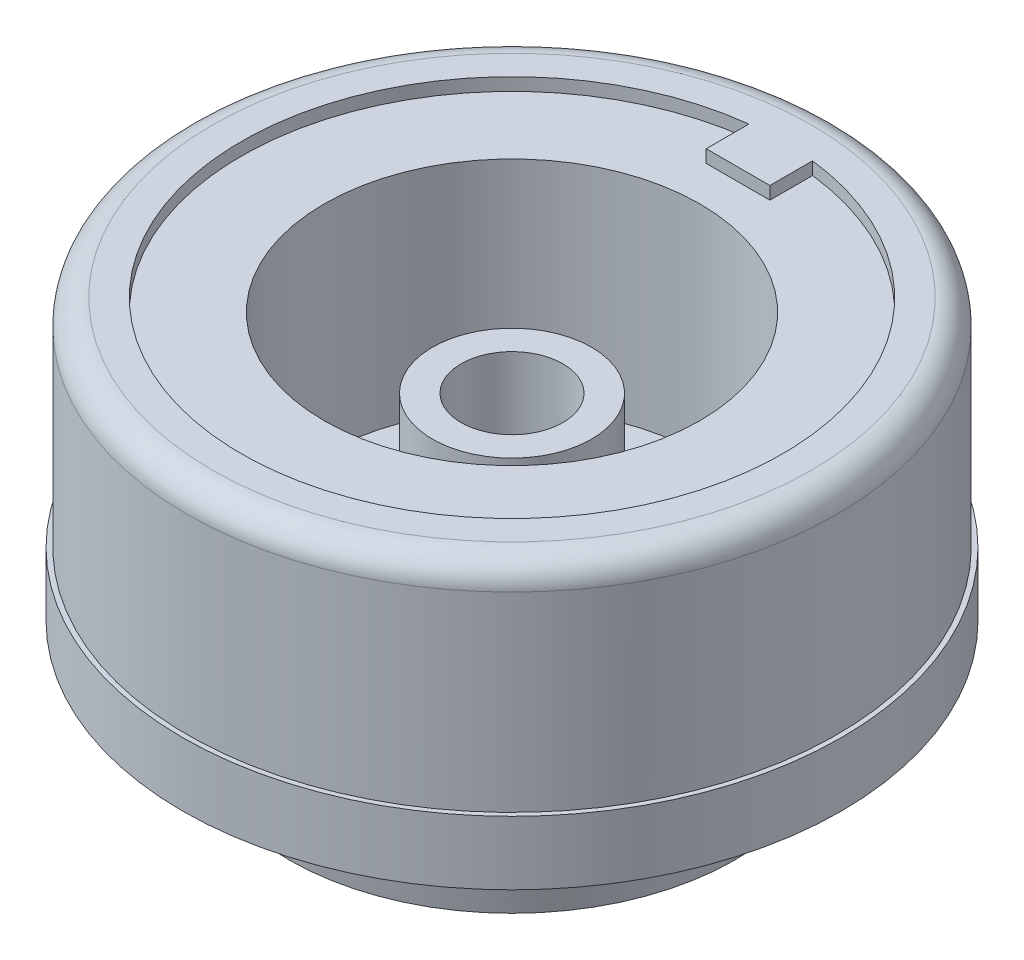
from build123d import *

# Parameters (mm, degrees)
FILLET1_R                            = 1.016
BOSS_EXTRUDE1_START                  = -2.54
SKETCH2_R                            = 13.1445
SKETCH2_R_2                          = 12.954
BOSS_EXTRUDE1_DEPTH                  = 2.54
CUT_EXTRUDE1_START                   = -0.508
SKETCH3_R                            = 7.493
CUT_EXTRUDE1_DEPTH                   = 0.508
CUT_EXTRUDE2_START                   = -3.302
CUT_EXTRUDE2_DEPTH                   = 3.302
RIB1_REACH                           = 25.878
SKETCH7_WALL_W                       = 52.380916808
SKETCH7_WALL_H                       = 1.524
BOSS_EXTRUDE2_REACH                  = 32.187
SKETCH9_W                            = 1.524
SKETCH9_H                            = 6.096
BOSS_EXTRUDE2_DIRECTION_2_REACH      = 32.187
BOSS_EXTRUDE2_DIRECTION_2_END_RADIUS = 9.525


# Read off the part's stored shape, not the designer's step: Draft1
with BuildPart() as part:
    # Sketch1 → Base-Revolve (revolve)
    with BuildSketch(Plane.XY, mode=Mode.PRIVATE) as base_revolve_sk:
        Polygon((12.954, 3.819921875), (12.954, 14.986), (7.493, 14.986), (7.493, 5.842), (3.175, 5.842), (3.175, 11.684), (2.032, 11.684), (2.032, 3.302), (7.493, 3.302), (7.493, 0), (9.525, 0), (9.525, 12.963921875), (11.938, 12.963921875), (11.938, 3.819921875), align=None)
    revolve(base_revolve_sk.sketch.rotate(Axis((0, 0, 0), (0, 1, 0)), 90), axis=Axis((0, 0, 0), (0, 1, 0)))

    # Fillet1
    fillet1_edges = [part.edges().sort_by_distance(p)[0] for p in [
        (0, 14.986, 12.954),
    ]]
    fillet(fillet1_edges, radius=FILLET1_R)

    # Sketch2 → Boss-Extrude1 (add)
    with BuildSketch(Plane.XZ.offset(-3.819921875).offset(BOSS_EXTRUDE1_START)):
        with Locations(Location((0, 0, 0), (0, 0, 270))):
            Circle(SKETCH2_R)
        with Locations(Location((0, 0, 0), (0, 0, 270))):
            Circle(SKETCH2_R_2, mode=Mode.SUBTRACT)
    extrude(amount=BOSS_EXTRUDE1_DEPTH)

    # Sketch3 → Cut-Extrude1 (cut)
    with BuildSketch(Plane(origin=(0, 14.986, 0), x_dir=(-1, 0, 0), z_dir=(0, 1, 0)).offset(CUT_EXTRUDE1_START)):
        with BuildLine():
            Line((1.27, -10.720033815), (1.27, -9.017))
            Line((1.27, -9.017), (-1.27, -9.017))
            Line((-1.27, -9.017), (-1.27, -10.720033815))
            ThreePointArc((-1.27, -10.720033815), (0, 10.795), (1.27, -10.720033815))
        make_face()
        with Locations(Location((0, 0, 0), (0, 0, 270))):
            Circle(SKETCH3_R, mode=Mode.SUBTRACT)
    extrude(amount=CUT_EXTRUDE1_DEPTH, mode=Mode.SUBTRACT)

    # Draft1 outline → Draft1 (revolve, cut)
    with BuildSketch(Plane.XY):
        Polygon((12.257315516, 3.819921875), (11.938, 12.963921875), (11.938, 3.819921875), align=None)
    revolve(axis=Axis((0, 0, 0), (0, 1, 0)), mode=Mode.SUBTRACT)

    # Sketch4 → Cut-Revolve1 (revolve, cut)
    with BuildSketch(Plane.XY, mode=Mode.PRIVATE) as cut_revolve1_sk:
        Polygon((9.525, 3.819921875), (9.144, 1.905), (8.89, 0), (9.525, 0), align=None)
    revolve(cut_revolve1_sk.sketch.rotate(Axis((0, 0, 0), (0, 1, 0)), 90), axis=Axis((0, 0, 0), (0, 1, 0)), mode=Mode.SUBTRACT)

    # Sketch5 → Boss-Revolve1 (revolve)
    with BuildSketch(Plane.XY, mode=Mode.PRIVATE) as boss_revolve1_sk:
        Polygon((2.032, 3.302), (2.032, 3.048), (3.556, 3.048), (3.556, 2.286), (5.969, 2.286), (5.969, 3.302), align=None)
    revolve(boss_revolve1_sk.sketch.rotate(Axis((0, 0, 0), (0, 1, 0)), 90), axis=Axis((0, 0, 0), (0, 1, 0)))

    # Sketch6 → Cut-Extrude2 (cut)
    with BuildSketch(Plane.XZ.offset(CUT_EXTRUDE2_START)):
        with BuildLine():
            Line((-6.174789514, 7.252420248), (-4.732067149, 5.809697884))
            ThreePointArc((-4.732067149, 5.809697884), (-5.298351111, 5.298351111), (-5.809697884, 4.732067149))
            Line((-5.809697884, 4.732067149), (-7.252420248, 6.174789514))
            ThreePointArc((-7.252420248, 6.174789514), (-6.735192091, 6.735192091), (-6.174789514, 7.252420248))
        make_face()
    extrude(amount=CUT_EXTRUDE2_DEPTH, mode=Mode.SUBTRACT)

    # Sketch7 wall → Rib1 (add, up to next)
    with BuildSketch(Plane(origin=(0, 6.867921875, 10.837938506), x_dir=(0, 0, -1), z_dir=(0, 1, 0)), mode=Mode.PRIVATE) as rib1_sk1:
        with Locations((0, -0.762)):
            Rectangle(SKETCH7_WALL_W, SKETCH7_WALL_H)
    rib1_tool1 = extrude(rib1_sk1.sketch, amount=RIB1_REACH, mode=Mode.PRIVATE) - part.part
    add(rib1_tool1.solids().sort_by_distance((0, 6.867921875, 10.837938506))[0])

    # Boss-Extrude2: up to this cone (the profile starts inside it)
    boss_extrude2_end = Plane(origin=(0, 9.915922, 0), z_dir=(0, -1, 0)) * Cone(10.482382248, 13.606494754, 89.462877002, mode=Mode.PRIVATE)
    # Sketch9 → Boss-Extrude2 (add, up to the surface)
    with BuildSketch(Plane.XY.offset(9.525), mode=Mode.PRIVATE) as boss_extrude2_sk1:
        with Locations((6.096, 9.915921875)):
            Rectangle(SKETCH9_W, SKETCH9_H)
    boss_extrude2_tool1 = extrude(boss_extrude2_sk1.sketch, amount=BOSS_EXTRUDE2_REACH, mode=Mode.PRIVATE) & boss_extrude2_end
    add(boss_extrude2_tool1.solids().sort_by_distance((6.096, 9.915922, 9.525))[0])

    # Boss-Extrude2 direction 2: up to this cylinder (the profile starts outside it)
    boss_extrude2_direction_2_end = Plane(origin=(0, 9.915922, 0), z_dir=(0, -1, 0)) * Cylinder(BOSS_EXTRUDE2_DIRECTION_2_END_RADIUS, 84.424, mode=Mode.PRIVATE)
    # Sketch9 → Boss-Extrude2 direction 2 (add, up to the surface)
    with BuildSketch(Plane.XY.offset(9.525), mode=Mode.PRIVATE) as boss_extrude2_direction_2_sk1:
        with Locations((6.096, 9.915921875)):
            Rectangle(SKETCH9_W, SKETCH9_H)
    boss_extrude2_direction_2_tool1 = extrude(boss_extrude2_direction_2_sk1.sketch, amount=-BOSS_EXTRUDE2_DIRECTION_2_REACH, mode=Mode.PRIVATE) - boss_extrude2_direction_2_end
    add(boss_extrude2_direction_2_tool1.solids().sort_by_distance((6.096, 9.915922, 9.525))[0])


solid = part.part
